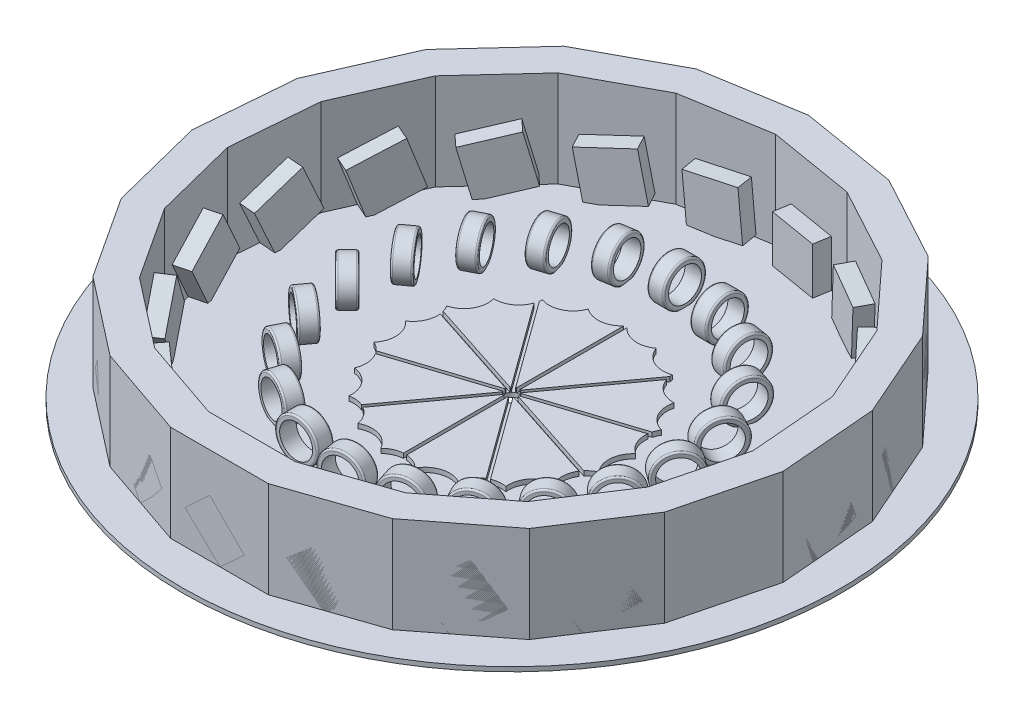
from build123d import *
from build123d.topology import SkipClean

# Parameters (mm, degrees)
SKETCH1_R                 = 100
SKETCH1_R_2               = 2
BASE_PLATTER_DEPTH        = 0.75
INNER_DESIGN_DEPTH        = 2
CUBE_FACE_REFERENCE_DEPTH = 29.8
SKETCH4_W                 = 14.815
SKETCH4_H                 = 14.82
FIRST_CUBE_DEPTH          = 14.82
BOSS_EXTRUDE6_DEPTH       = 14.82
BOSS_EXTRUDE7_DEPTH       = 14.82
BOSS_EXTRUDE9_DEPTH       = 14.82
BOSS_EXTRUDE10_DEPTH      = 14.82
BOSS_EXTRUDE11_DEPTH      = 14.82
BOSS_EXTRUDE12_DEPTH      = 14.82
BOSS_EXTRUDE14_DEPTH      = 14.82
BOSS_EXTRUDE15_DEPTH      = 14.82
BOSS_EXTRUDE16_DEPTH      = 14.82
BOSS_EXTRUDE18_DEPTH      = 14.82
BOSS_EXTRUDE19_DEPTH      = 14.82
BOSS_EXTRUDE20_DEPTH      = 14.82
BOSS_EXTRUDE21_DEPTH      = 14.82
BOSS_EXTRUDE23_DEPTH      = 14.82
BOSS_EXTRUDE24_DEPTH      = 14.82
BOSS_EXTRUDE25_DEPTH      = 14.82
BOSS_EXTRUDE26_DEPTH      = 14.82
BOSS_EXTRUDE27_DEPTH      = 14.82
SKETCH23_W                = 5
SKETCH23_H                = 13
RINGS_DEPTH               = 13
RINGS_2_DEPTH             = 13
RINGS_3_DEPTH             = 13
RINGS_4_DEPTH             = 13
RINGS_5_DEPTH             = 13
RINGS_6_DEPTH             = 13
RINGS_7_DEPTH             = 13
RINGS_8_DEPTH             = 13
RINGS_9_DEPTH             = 13
RINGS_10_DEPTH            = 13
RINGS_11_DEPTH            = 13
SKETCH23_W_2              = 13
SKETCH23_H_2              = 5
RINGS_12_DEPTH            = 13
RINGS_13_DEPTH            = 13
RINGS_14_DEPTH            = 13
RINGS_15_DEPTH            = 13
RINGS_16_DEPTH            = 13
RINGS_17_DEPTH            = 13
RINGS_18_DEPTH            = 13
RINGS_19_DEPTH            = 13
RINGS_20_DEPTH            = 13
SKETCH26_R                = 5
CUT_EXTRUDE2_DEPTH        = 5
SKETCH27_R                = 5
CUT_EXTRUDE3_DEPTH        = 5
SKETCH28_R                = 5
CUT_EXTRUDE4_DEPTH        = 5
SKETCH29_R                = 5
CUT_EXTRUDE5_DEPTH        = 5
SKETCH30_R                = 5
CUT_EXTRUDE6_DEPTH        = 5
SKETCH31_R                = 5
CUT_EXTRUDE7_DEPTH        = 5
SKETCH32_R                = 5
CUT_EXTRUDE8_DEPTH        = 5
SKETCH33_R                = 5
CUT_EXTRUDE9_DEPTH        = 5
SKETCH34_R                = 5
CUT_EXTRUDE10_DEPTH       = 5
SKETCH35_R                = 5
CUT_EXTRUDE11_DEPTH       = 5
SKETCH36_R                = 5
CUT_EXTRUDE12_DEPTH       = 5
SKETCH37_R                = 5
CUT_EXTRUDE13_DEPTH       = 5
SKETCH38_R                = 5
CUT_EXTRUDE14_DEPTH       = 5
SKETCH39_R                = 5
CUT_EXTRUDE15_DEPTH       = 5
SKETCH40_R                = 5
CUT_EXTRUDE16_DEPTH       = 5
SKETCH41_R                = 5
CUT_EXTRUDE17_DEPTH       = 5
SKETCH42_R                = 5
CUT_EXTRUDE18_DEPTH       = 5
SKETCH43_R                = 5
CUT_EXTRUDE19_DEPTH       = 5
SKETCH44_R                = 5
CUT_EXTRUDE20_DEPTH       = 5
SKETCH45_R                = 5
CUT_EXTRUDE21_DEPTH       = 5
SKETCH46_R                = 100
SKETCH46_R_2              = 2
BOSS_EXTRUDE29_DEPTH      = 0.6
FILLET1_R                 = 0.5


with BuildPart() as part:
    # Sketch1 → Base Platter (new body)
    with BuildSketch(Plane(origin=(0, 0, 0), x_dir=(1, 0, 0), z_dir=(0, 1, 0))):
        with Locations(Location((0, 0, 0), (0, 0, 270))):
            Circle(SKETCH1_R)
        with Locations(Location((0, 0, 0), (0, 0, 270))):
            Circle(SKETCH1_R_2, mode=Mode.SUBTRACT)
    extrude(amount=BASE_PLATTER_DEPTH)

    # Sketch2 → Inner Design (add)
    with SkipClean():  # the faces are left unmerged after this step: merging them gives an invalid solid
        with BuildSketch(Plane(origin=(0, 0.75, 0), x_dir=(1, 0, 0), z_dir=(0, 1, 0))):
            with BuildLine():
                Line((1.687204527, 1.073937095), (31.717554771, 10.831389374))
                ThreePointArc((31.717554771, 10.831389374), (32.077866011, 11.840585639), (32.580581203, 12.786935853))
                ThreePointArc((32.580581203, 12.786935853), (28.101088861, 16.224171219), (27.364101886, 21.822143065))
                ThreePointArc((27.364101886, 21.822143065), (22.905478425, 23.11738672), (20.103647043, 26.819645517))
                Line((20.103647043, 26.819645517), (1.542749744, 1.272762047))
                ThreePointArc((1.542749744, 1.272762047), (1.618033989, 1.175570505), (1.687204527, 1.073937095))
            make_face()
            with BuildLine():
                ThreePointArc((34.902132901, 2.615553276), (32.175877146, 5.670588971), (31.498589471, 9.708781011))
                Line((31.498589471, 9.708781011), (1.996221522, 0.122880578))
                ThreePointArc((1.996221522, 0.122880578), (2, 0), (1.996221522, -0.122880578))
                Line((1.996221522, -0.122880578), (31.504359628, -9.710655848))
                ThreePointArc((31.504359628, -9.710655848), (32.706301363, -8.603563459), (34.122476926, -7.788232688))
                ThreePointArc((34.122476926, -7.788232688), (32.357610291, -2.424867667), (34.902132901, 2.615553276))
            make_face()
            with BuildLine():
                ThreePointArc((0.5, 1.936491673), (0.618033989, 1.902113033), (0.733732749, 1.860547299))
                Line((0.733732749, 1.860547299), (19.793527795, 28.094104608))
                ThreePointArc((19.793527795, 28.094104608), (19.74329359, 28.505145312), (19.716202032, 28.918357101))
                ThreePointArc((19.716202032, 28.918357101), (14.078808145, 29.234946351), (10.316431104, 33.445048203))
                ThreePointArc((10.316431104, 33.445048203), (5.226515642, 32.037689702), (0.5, 34.39309779))
                Line((0.5, 34.39309779), (0.5, 1.936491673))
            make_face()
            with BuildLine():
                Line((30.869988169, -10.555998291), (1.687204527, -1.073937095))
                ThreePointArc((1.687204527, -1.073937095), (1.618033989, -1.175570505), (1.542749744, -1.272762047))
                Line((1.542749744, -1.272762047), (19.58219661, -26.101930568))
                ThreePointArc((19.58219661, -26.101930568), (21.661395702, -25.568829433), (23.806045822, -25.656815514))
                ThreePointArc((23.806045822, -25.656815514), (25.369135671, -20.231210597), (30.310889132, -17.5))
                ThreePointArc((30.310889132, -17.5), (29.719147495, -13.957846794), (30.869988169, -10.555998291))
            make_face()
            with BuildLine():
                ThreePointArc((-0.733732749, 1.860547299), (-0.618033989, 1.902113033), (-0.5, 1.936491673))
                Line((-0.5, 1.936491673), (-0.5, 34.39309779))
                ThreePointArc((-0.5, 34.39309779), (-5.226515642, 32.037689702), (-10.316431104, 33.445048203))
                ThreePointArc((-10.316431104, 33.445048203), (-14.078808145, 29.234946351), (-19.716202032, 28.918357101))
                ThreePointArc((-19.716202032, 28.918357101), (-19.74329359, 28.505145312), (-19.793527795, 28.094104608))
                Line((-19.793527795, 28.094104608), (-0.733732749, 1.860547299))
            make_face()
            with BuildLine():
                Line((18.676757461, -26.557002111), (0.733732749, -1.860547299))
                ThreePointArc((0.733732749, -1.860547299), (0.618033989, -1.902113033), (0.5, -1.936491673))
                Line((0.5, -1.936491673), (0.5, -32.465306002))
                ThreePointArc((0.5, -32.465306002), (3.052617651, -33.109544655), (5.216479316, -34.609078918))
                ThreePointArc((5.216479316, -34.609078918), (9.564316834, -31.006753626), (15.185930869, -31.533910377))
                ThreePointArc((15.185930869, -31.533910377), (16.394873379, -28.66917314), (18.676757461, -26.557002111))
            make_face()
            with BuildLine():
                ThreePointArc((-1.687204527, 1.073937095), (-1.618033989, 1.175570505), (-1.542749744, 1.272762047))
                Line((-1.542749744, 1.272762047), (-20.103647043, 26.819645517))
                ThreePointArc((-20.103647043, 26.819645517), (-22.905478425, 23.11738672), (-27.364101886, 21.822143065))
                ThreePointArc((-27.364101886, 21.822143065), (-28.101088861, 16.224171219), (-32.580581203, 12.786935853))
                ThreePointArc((-32.580581203, 12.786935853), (-32.077866011, 11.840585639), (-31.717554771, 10.831389374))
                Line((-31.717554771, 10.831389374), (-1.687204527, 1.073937095))
            make_face()
            with BuildLine():
                Line((-0.5, -32.465306002), (-0.5, -1.936491673))
                ThreePointArc((-0.5, -1.936491673), (-0.618033989, -1.902113033), (-0.733732749, -1.860547299))
                Line((-0.733732749, -1.860547299), (-18.676757461, -26.557002111))
                ThreePointArc((-18.676757461, -26.557002111), (-16.394873379, -28.66917314), (-15.185930869, -31.533910377))
                ThreePointArc((-15.185930869, -31.533910377), (-9.564316834, -31.006753626), (-5.216479316, -34.609078918))
                ThreePointArc((-5.216479316, -34.609078918), (-3.052617651, -33.109544655), (-0.5, -32.465306002))
            make_face()
            with BuildLine():
                ThreePointArc((-1.996221522, -0.122880578), (-2, 0), (-1.996221522, 0.122880578))
                Line((-1.996221522, 0.122880578), (-31.498589471, 9.708781011))
                ThreePointArc((-31.498589471, 9.708781011), (-32.175877146, 5.670588971), (-34.902132901, 2.615553276))
                ThreePointArc((-34.902132901, 2.615553276), (-32.357610291, -2.424867667), (-34.122476926, -7.788232688))
                ThreePointArc((-34.122476926, -7.788232688), (-32.706301363, -8.603563459), (-31.504359628, -9.710655848))
                Line((-31.504359628, -9.710655848), (-1.996221522, -0.122880578))
            make_face()
            with BuildLine():
                ThreePointArc((-1.542749744, -1.272762047), (-1.618033989, -1.175570505), (-1.687204527, -1.073937095))
                Line((-1.687204527, -1.073937095), (-30.869988169, -10.555998291))
                ThreePointArc((-30.869988169, -10.555998291), (-29.719147495, -13.957846794), (-30.310889132, -17.5))
                ThreePointArc((-30.310889132, -17.5), (-25.369135671, -20.231210597), (-23.806045822, -25.656815514))
                ThreePointArc((-23.806045822, -25.656815514), (-21.661395702, -25.568829433), (-19.58219661, -26.101930568))
                Line((-19.58219661, -26.101930568), (-1.542749744, -1.272762047))
            make_face()
        extrude(amount=INNER_DESIGN_DEPTH)



with BuildPart() as body_2:
    # Sketch3 → Cube Face Reference (new body)
    with BuildSketch(Plane(origin=(0, 0.75, 0), x_dir=(1, 0, 0), z_dir=(0, 1, 0))):
        Polygon((0, 90), (-29.222952228, 85.123551753), (-55.279144142, 71.022645846), (-75.344983044, 49.225334231), (-87.246023935, 22.093693843), (-89.692604371, -7.432141093), (-82.419599399, -36.152588219), (-66.215151961, -60.955341446), (-42.835265373, -79.152637609), (-14.813513125, -88.772517306), (14.813513125, -88.772517306), (42.835265373, -79.152637609), (66.215151961, -60.955341446), (82.419599399, -36.152588219), (89.692604371, -7.432141093), (87.246023935, 22.093693843), (75.344983044, 49.225334231), (55.279144142, 71.022645846), (29.222952228, 85.123551753), align=None)
        Polygon((0, 80), (-25.975957536, 75.665379336), (-49.137017015, 63.131240752), (-66.973318261, 43.75585265), (-77.552021275, 19.638838971), (-79.726759441, -6.606347638), (-73.261866132, -32.135633972), (-58.857912854, -54.18252573), (-38.075791443, -70.357900097), (-13.167567222, -78.908904272), (13.167567222, -78.908904272), (38.075791443, -70.357900097), (58.857912854, -54.18252573), (73.261866132, -32.135633972), (79.726759441, -6.606347638), (77.552021275, 19.638838971), (66.973318261, 43.75585265), (49.137017015, 63.131240752), (25.975957536, 75.665379336), align=None, mode=Mode.SUBTRACT)
    extrude(amount=CUBE_FACE_REFERENCE_DEPTH)


with BuildPart() as body_3:
    # Sketch4 → First Cube (new body)
    with BuildSketch(Plane(origin=(14.611476114, 0, -87.561775877), x_dir=(-0.9863613034027224, 0, -0.1645945902807338), z_dir=(0.1645945902807338, 0, -0.9863613034027224))):
        with Locations((0, 8.16)):
            Rectangle(SKETCH4_W, SKETCH4_H)
    extrude(amount=-FIRST_CUBE_DEPTH)


with BuildPart() as body_4:
    # Sketch5 → Boss-Extrude6 (new body)
    with BuildSketch(Plane(origin=(42.251048185, 0, -78.073098799), x_dir=(-0.879473751206489, 0, -0.4759473930370738), z_dir=(0.4759473930370738, 0, -0.879473751206489))):
        Polygon((-6.772778143, 0.75), (7.996604043, 1.9738259), (6.772778143, 16.743208086), (-7.996604043, 15.519382186), align=None)
    extrude(amount=-BOSS_EXTRUDE6_DEPTH)


with BuildPart() as body_5:
    # Sketch6 → Boss-Extrude7 (new body)
    with BuildSketch(Plane(origin=(65.312063593, 0, -60.123990038), x_dir=(-0.6772815716257411, 0, -0.7357239106731317), z_dir=(0.7357239106731317, 0, -0.6772815716257411))):
        Polygon((-6.089291344, 0.75), (-8.528583172, 15.367874516), (6.089291344, 17.807166344), (8.528583172, 3.189291828), align=None)
    extrude(amount=-BOSS_EXTRUDE7_DEPTH)


with BuildPart() as body_6:
    # Sketch7 → Boss-Extrude9 (new body)
    with BuildSketch(Plane(origin=(81.295503489, 0, -35.659514037), x_dir=(-0.4016954246529692, 0, -0.9157733266550576), z_dir=(0.9157733266550576, 0, -0.4016954246529692))):
        Polygon((-5.364208511, 0.75), (-9.00230343, 15.116511941), (5.364208511, 18.754606861), (9.00230343, 4.388094919), align=None)
    extrude(amount=-BOSS_EXTRUDE9_DEPTH)


with BuildPart() as body_7:
    # Sketch8 → Boss-Extrude10 (new body)
    with BuildSketch(Plane(origin=(88.469314153, 0, -7.330776375), x_dir=(-0.08257934547233238, 0, -0.9965844930066698), z_dir=(0.99658449300667, 0, -0.0825793454723324))):
        Polygon((-4.602482694, 0.75), (-9.414528828, 14.767011522), (4.602482694, 19.579057656), (9.414528828, 5.562046134), align=None)
    extrude(amount=-BOSS_EXTRUDE10_DEPTH)


with BuildPart() as body_8:
    # Sketch9 → Boss-Extrude11 (new body)
    with BuildSketch(Plane(origin=(86.056101885, 0, 21.792364656), x_dir=(0.24548548714079937, 0, -0.9694002659393304), z_dir=(0.9694002659393305, 0, 0.2454854871407994))):
        Polygon((3.809317254, 20.274886894), (-9.762443447, 14.321760701), (0, 10.512443447), align=None)
        Polygon((0, 10.512443447), (9.762443447, 6.703126193), (3.809317254, 20.274886894), align=None)
        Polygon((0, 10.512443447), (-3.809317254, 0.75), (9.762443447, 6.703126193), align=None)
        Polygon((-9.762443447, 14.321760701), (-3.809317254, 0.75), (0, 10.512443447), align=None)
    extrude(amount=-BOSS_EXTRUDE11_DEPTH)


with BuildPart() as body_9:
    # Sketch10 → Boss-Extrude12 (new body)
    with BuildSketch(Plane(origin=(74.31737568, 0, 48.553964833), x_dir=(0.5469481581224269, 0, -0.8371664782625287), z_dir=(0.8371664782625287, 0, 0.5469481581224269))):
        Polygon((-2.990130314, 0.75), (-10.043670679, 13.783800993), (2.990130314, 20.837341358), (10.043670679, 7.803540365), align=None)
    extrude(amount=-BOSS_EXTRUDE12_DEPTH)


with BuildPart() as body_10:
    # Sketch11 → Boss-Extrude14 (new body)
    with BuildSketch(Plane(origin=(54.525208667, 0, 70.053989527), x_dir=(0.7891405093963932, 0, -0.6142127126896683), z_dir=(0.6142127126896683, 0, 0.7891405093963932))):
        Polygon((-2.150517752, 0.75), (-10.256289456, 13.156807208), (2.150517752, 21.262578911), (10.256289456, 8.855771703), align=None)
    extrude(amount=-BOSS_EXTRUDE14_DEPTH)


with BuildPart() as body_11:
    # Sketch12 → Boss-Extrude15 (new body)
    with BuildSketch(Plane(origin=(28.824389249, 0, 83.962577457), x_dir=(0.9458172417006347, 0, -0.3246994692046836), z_dir=(0.3246994692046836, 0, 0.9458172417006347))):
        Polygon((-1.296214974, 0.75), (-10.398847376, 12.445062349), (1.296214974, 21.547694751), (10.398847376, 9.852632402), align=None)
    extrude(amount=-BOSS_EXTRUDE15_DEPTH)


with BuildPart() as body_12:
    # Sketch13 → Boss-Extrude16 (new body)
    with BuildSketch(Plane.XY.offset(88.772517306)):
        Polygon((-0.433057732, 0.75), (-10.470370624, 11.653428356), (0.433057732, 21.690741248), (10.470370624, 10.787312891), align=None)
    extrude(amount=-BOSS_EXTRUDE16_DEPTH)


with BuildPart() as body_13:
    # Sketch14 → Boss-Extrude18 (new body)
    with BuildSketch(Plane(origin=(-28.824389249, 0, 83.962577457), x_dir=(0.9458172417006347, 0, 0.3246994692046836), z_dir=(-0.3246994692046836, 0, 0.9458172417006347))):
        Polygon((0.433057732, 0.75), (-10.470370624, 10.787312891), (-0.433057732, 21.690741248), (10.470370624, 11.653428356), align=None)
    extrude(amount=-BOSS_EXTRUDE18_DEPTH)


with BuildPart() as body_14:
    # Sketch15 → Boss-Extrude19 (new body)
    with BuildSketch(Plane(origin=(-54.525208667, 0, 70.053989527), x_dir=(0.7891405093963937, 0, 0.6142127126896679), z_dir=(-0.6142127126896679, 0, 0.7891405093963937))):
        Polygon((1.296214974, 0.75), (-10.398847376, 9.852632402), (-1.296214974, 21.547694751), (10.398847376, 12.445062349), align=None)
    extrude(amount=-BOSS_EXTRUDE19_DEPTH)


with BuildPart() as body_15:
    # Sketch16 → Boss-Extrude20 (new body)
    with BuildSketch(Plane(origin=(-74.31737568, 0, 48.553964833), x_dir=(0.5469481581224271, 0, 0.8371664782625285), z_dir=(-0.8371664782625284, 0, 0.546948158122427))):
        Polygon((2.150517752, 0.75), (-10.256289456, 8.855771703), (-2.150517752, 21.262578911), (10.256289456, 13.156807208), align=None)
    extrude(amount=-BOSS_EXTRUDE20_DEPTH)


with BuildPart() as body_16:
    # Sketch17 → Boss-Extrude21 (new body)
    with BuildSketch(Plane(origin=(-86.056101885, 0, 21.792364656), x_dir=(0.24548548714079926, 0, 0.9694002659393304), z_dir=(-0.9694002659393305, 0, 0.2454854871407993))):
        Polygon((2.990130314, 0.75), (-10.043670679, 7.803540365), (-2.990130314, 20.837341358), (10.043670679, 13.783800993), align=None)
    extrude(amount=-BOSS_EXTRUDE21_DEPTH)


with BuildPart() as body_17:
    # Sketch18 → Boss-Extrude23 (new body)
    with BuildSketch(Plane(origin=(-88.469314153, 0, -7.330776375), x_dir=(-0.08257934547233221, 0, 0.9965844930066698), z_dir=(-0.99658449300667, 0, -0.08257934547233223))):
        Polygon((3.809317254, 0.75), (-9.762443447, 6.703126193), (-3.809317254, 20.274886894), (9.762443447, 14.321760701), align=None)
    extrude(amount=-BOSS_EXTRUDE23_DEPTH)


with BuildPart() as body_18:
    # Sketch19 → Boss-Extrude24 (new body)
    with BuildSketch(Plane(origin=(-81.295503489, 0, -35.659514037), x_dir=(-0.40169542465296904, 0, 0.9157733266550577), z_dir=(-0.9157733266550576, 0, -0.401695424652969))):
        Polygon((4.602482694, 0.75), (-9.414528828, 5.562046134), (-4.602482694, 19.579057656), (9.414528828, 14.767011522), align=None)
    extrude(amount=-BOSS_EXTRUDE24_DEPTH)


with BuildPart() as body_19:
    # Sketch20 → Boss-Extrude25 (new body)
    with BuildSketch(Plane(origin=(-65.312063593, 0, -60.123990038), x_dir=(-0.6772815716257413, 0, 0.7357239106731314), z_dir=(-0.7357239106731314, 0, -0.6772815716257413))):
        Polygon((5.364208511, 0.75), (-9.00230343, 4.388094919), (-5.364208511, 18.754606861), (9.00230343, 15.116511941), align=None)
    extrude(amount=-BOSS_EXTRUDE25_DEPTH)


with BuildPart() as body_20:
    # Sketch21 → Boss-Extrude26 (new body)
    with BuildSketch(Plane(origin=(-42.251048185, 0, -78.073098799), x_dir=(-0.8794737512064889, 0, 0.47594739303707395), z_dir=(-0.47594739303707395, 0, -0.8794737512064889))):
        Polygon((6.089291344, 0.75), (-8.528583172, 3.189291828), (-6.089291344, 17.807166344), (8.528583172, 15.367874516), align=None)
    extrude(amount=-BOSS_EXTRUDE26_DEPTH)


with BuildPart() as body_21:
    # Sketch22 → Boss-Extrude27 (new body)
    with BuildSketch(Plane(origin=(-14.611476114, 0, -87.561775877), x_dir=(-0.9863613034027224, 0, 0.16459459028073373), z_dir=(-0.16459459028073373, 0, -0.9863613034027224))):
        Polygon((6.772778143, 0.75), (-7.996604043, 1.9738259), (-6.772778143, 16.743208086), (7.996604043, 15.519382186), align=None)
    extrude(amount=-BOSS_EXTRUDE27_DEPTH)


with BuildPart() as body_22:
    # Sketch23 → Rings (new body)
    with BuildSketch(Plane(origin=(0, 0.75, 0), x_dir=(1, 0, 0), z_dir=(0, 1, 0))):
        with Locations((15.450849719, 47.552825815)):
            Rectangle(SKETCH23_W, SKETCH23_H)
    extrude(amount=RINGS_DEPTH)

    # Sketch28 → Cut-Extrude4 (cut)
    with BuildSketch(Plane(origin=(17.950849719, 0, 0), x_dir=(0, 0, -1), z_dir=(1, 0, 0))):
        with BuildLine():
            Line((47.552825815, 13.75), (41.052825815, 13.75))
            Line((41.052825815, 13.75), (41.052825815, 7.25))
            ThreePointArc((41.052825815, 7.25), (42.956631737, 11.846194078), (47.552825815, 13.75))
        make_face()
        with BuildLine():
            ThreePointArc((47.552825815, 0.75), (42.956631737, 2.653805922), (41.052825815, 7.25))
            Line((41.052825815, 7.25), (41.052825815, 0.75))
            Line((41.052825815, 0.75), (47.552825815, 0.75))
        make_face()
        with Locations((47.552825815, 7.25)):
            Circle(SKETCH28_R)
        with BuildLine():
            Line((54.052825815, 13.75), (47.552825815, 13.75))
            ThreePointArc((47.552825815, 13.75), (52.149019892, 11.846194078), (54.052825815, 7.25))
            Line((54.052825815, 7.25), (54.052825815, 13.75))
        make_face()
        with BuildLine():
            Line((54.052825815, 0.75), (54.052825815, 7.25))
            ThreePointArc((54.052825815, 7.25), (52.149019892, 2.653805922), (47.552825815, 0.75))
            Line((47.552825815, 0.75), (54.052825815, 0.75))
        make_face()
    extrude(amount=-CUT_EXTRUDE4_DEPTH, mode=Mode.SUBTRACT)


with BuildPart() as body_23:
    # Sketch23 → Rings 2 (new body)
    with BuildSketch(Plane(origin=(0, 0.75, 0), x_dir=(1, 0, 0), z_dir=(0, 1, 0))):
        with Locations((0, 50)):
            Rectangle(SKETCH23_W, SKETCH23_H)
    extrude(amount=RINGS_2_DEPTH)

    # Sketch27 → Cut-Extrude3 (cut)
    with BuildSketch(Plane(origin=(2.5, 0, 0), x_dir=(0, 0, -1), z_dir=(1, 0, 0))):
        with Locations((50, 7.25)):
            Circle(SKETCH27_R)
        with BuildLine():
            Line((50, 13.75), (43.5, 13.75))
            Line((43.5, 13.75), (43.5, 7.25))
            ThreePointArc((43.5, 7.25), (45.403805922, 11.846194078), (50, 13.75))
        make_face()
        with BuildLine():
            ThreePointArc((50, 0.75), (45.403805922, 2.653805922), (43.5, 7.25))
            Line((43.5, 7.25), (43.5, 0.75))
            Line((43.5, 0.75), (50, 0.75))
        make_face()
        with BuildLine():
            Line((56.5, 13.75), (50, 13.75))
            ThreePointArc((50, 13.75), (54.596194078, 11.846194078), (56.5, 7.25))
            Line((56.5, 7.25), (56.5, 13.75))
        make_face()
        with BuildLine():
            Line((56.5, 0.75), (56.5, 7.25))
            ThreePointArc((56.5, 7.25), (54.596194078, 2.653805922), (50, 0.75))
            Line((50, 0.75), (56.5, 0.75))
        make_face()
    extrude(amount=-CUT_EXTRUDE3_DEPTH, mode=Mode.SUBTRACT)


with BuildPart() as body_24:
    # Sketch23 → Rings 3 (new body)
    with BuildSketch(Plane(origin=(0, 0.75, 0), x_dir=(1, 0, 0), z_dir=(0, 1, 0))):
        Polygon((27.936865786, 47.261910095), (32.875307489, 46.47973777), (30.841659443, 33.639789342), (25.90321774, 34.421961667), align=None)
    extrude(amount=RINGS_3_DEPTH)

    # Sketch29 → Cut-Extrude5 (cut)
    with BuildSketch(Plane(origin=(24.889277018, 0, 3.942074211), x_dir=(0.15643446504023656, 0, -0.9876883405951369), z_dir=(0.9876883405951368, 0, 0.15643446504023653))):
        with Locations((44.550326209, 7.25)):
            Circle(SKETCH29_R)
        with BuildLine():
            Line((44.550326209, 13.75), (38.050326209, 13.75))
            Line((38.050326209, 13.75), (38.050326209, 7.25))
            ThreePointArc((38.050326209, 7.25), (39.954132132, 11.846194078), (44.550326209, 13.75))
        make_face()
        with BuildLine():
            ThreePointArc((44.550326209, 0.75), (39.954132132, 2.653805922), (38.050326209, 7.25))
            Line((38.050326209, 7.25), (38.050326209, 0.75))
            Line((38.050326209, 0.75), (44.550326209, 0.75))
        make_face()
        with BuildLine():
            Line((51.050326209, 0.75), (51.050326209, 7.25))
            ThreePointArc((51.050326209, 7.25), (49.146520287, 2.653805922), (44.550326209, 0.75))
            Line((44.550326209, 0.75), (51.050326209, 0.75))
        make_face()
        with BuildLine():
            Line((51.050326209, 13.75), (44.550326209, 13.75))
            ThreePointArc((44.550326209, 13.75), (49.146520287, 11.846194078), (51.050326209, 7.25))
            Line((51.050326209, 7.25), (51.050326209, 13.75))
        make_face()
    extrude(amount=-CUT_EXTRUDE5_DEPTH, mode=Mode.SUBTRACT)


with BuildPart() as body_25:
    # Sketch23 → Rings 4 (new body)
    with BuildSketch(Plane(origin=(0, 0.75, 0), x_dir=(1, 0, 0), z_dir=(0, 1, 0))):
        Polygon((40.081818891, 36.343672456), (36.064597965, 23.979937745), (40.819880546, 22.434852773), (44.837101473, 34.798587485), align=None)
    extrude(amount=RINGS_4_DEPTH)

    # Sketch30 → Cut-Extrude6 (cut)
    with BuildSketch(Plane(origin=(30.328491009, 0, 9.854324086), x_dir=(0.3090169943749453, 0, -0.9510565162951543), z_dir=(0.9510565162951544, 0, 0.3090169943749453))):
        with BuildLine():
            Line((40.450849719, 13.75), (33.950849719, 13.75))
            Line((33.950849719, 13.75), (33.950849719, 7.25))
            ThreePointArc((33.950849719, 7.25), (35.854655641, 11.846194078), (40.450849719, 13.75))
        make_face()
        with BuildLine():
            ThreePointArc((40.450849719, 0.75), (35.854655641, 2.653805922), (33.950849719, 7.25))
            Line((33.950849719, 7.25), (33.950849719, 0.75))
            Line((33.950849719, 0.75), (40.450849719, 0.75))
        make_face()
        with Locations((40.450849719, 7.25)):
            Circle(SKETCH30_R)
        with BuildLine():
            Line((46.950849719, 13.75), (40.450849719, 13.75))
            ThreePointArc((40.450849719, 13.75), (45.047043796, 11.846194078), (46.950849719, 7.25))
            Line((46.950849719, 7.25), (46.950849719, 13.75))
        make_face()
        with BuildLine():
            Line((46.950849719, 0.75), (46.950849719, 7.25))
            ThreePointArc((46.950849719, 7.25), (45.047043796, 2.653805922), (40.450849719, 0.75))
            Line((40.450849719, 0.75), (46.950849719, 0.75))
        make_face()
    extrude(amount=-CUT_EXTRUDE6_DEPTH, mode=Mode.SUBTRACT)


with BuildPart() as body_26:
    # Sketch23 → Rings 5 (new body)
    with BuildSketch(Plane(origin=(0, 0.75, 0), x_dir=(1, 0, 0), z_dir=(0, 1, 0))):
        Polygon((48.276247753, 22.377368375), (42.374371256, 10.794283561), (46.829403877, 8.524331062), (52.731280374, 20.107415877), align=None)
    extrude(amount=RINGS_5_DEPTH)

    # Sketch31 → Cut-Extrude7 (cut)
    with BuildSketch(Plane(origin=(33.729354077, 0, 17.185964297), x_dir=(0.4539904997395454, 0, -0.8910065241883687), z_dir=(0.8910065241883686, 0, 0.45399049973954536))):
        with BuildLine():
            Line((35.355339059, 13.75), (28.855339059, 13.75))
            Line((28.855339059, 13.75), (28.855339059, 7.25))
            ThreePointArc((28.855339059, 7.25), (30.759144982, 11.846194078), (35.355339059, 13.75))
        make_face()
        with BuildLine():
            ThreePointArc((35.355339059, 0.75), (30.759144982, 2.653805922), (28.855339059, 7.25))
            Line((28.855339059, 7.25), (28.855339059, 0.75))
            Line((28.855339059, 0.75), (35.355339059, 0.75))
        make_face()
        with Locations((35.355339059, 7.25)):
            Circle(SKETCH31_R)
        with BuildLine():
            Line((41.855339059, 13.75), (35.355339059, 13.75))
            ThreePointArc((35.355339059, 13.75), (39.951533137, 11.846194078), (41.855339059, 7.25))
            Line((41.855339059, 7.25), (41.855339059, 13.75))
        make_face()
        with BuildLine():
            Line((41.855339059, 0.75), (41.855339059, 7.25))
            ThreePointArc((41.855339059, 7.25), (39.951533137, 2.653805922), (35.355339059, 0.75))
            Line((35.355339059, 0.75), (41.855339059, 0.75))
        make_face()
    extrude(amount=-CUT_EXTRUDE7_DEPTH, mode=Mode.SUBTRACT)


with BuildPart() as body_27:
    # Sketch23 → Rings 6 (new body)
    with BuildSketch(Plane(origin=(0, 0.75, 0), x_dir=(1, 0, 0), z_dir=(0, 1, 0))):
        Polygon((51.798061654, 6.728073594), (44.156853374, -3.789147333), (48.201938346, -6.728073594), (55.843146626, 3.789147333), align=None)
    extrude(amount=RINGS_6_DEPTH)

    # Sketch32 → Cut-Extrude8 (cut)
    with BuildSketch(Plane(origin=(34.747967345, 0, 25.245876038), x_dir=(0.5877852522924715, 0, -0.8090169943749487), z_dir=(0.8090169943749487, 0, 0.5877852522924715))):
        with BuildLine():
            Line((29.389262615, 13.75), (22.889262615, 13.75))
            Line((22.889262615, 13.75), (22.889262615, 7.25))
            ThreePointArc((22.889262615, 7.25), (24.793068537, 11.846194078), (29.389262615, 13.75))
        make_face()
        with BuildLine():
            ThreePointArc((29.389262615, 0.75), (24.793068537, 2.653805922), (22.889262615, 7.25))
            Line((22.889262615, 7.25), (22.889262615, 0.75))
            Line((22.889262615, 0.75), (29.389262615, 0.75))
        make_face()
        with Locations((29.389262615, 7.25)):
            Circle(SKETCH32_R)
        with BuildLine():
            Line((35.889262615, 13.75), (29.389262615, 13.75))
            ThreePointArc((29.389262615, 13.75), (33.985456692, 11.846194078), (35.889262615, 7.25))
            Line((35.889262615, 7.25), (35.889262615, 13.75))
        make_face()
        with BuildLine():
            Line((35.889262615, 0.75), (35.889262615, 7.25))
            ThreePointArc((35.889262615, 7.25), (33.985456692, 2.653805922), (29.389262615, 0.75))
            Line((29.389262615, 0.75), (35.889262615, 0.75))
        make_face()
    extrude(amount=-CUT_EXTRUDE8_DEPTH, mode=Mode.SUBTRACT)


with BuildPart() as body_28:
    # Sketch23 → Rings 7 (new body)
    with BuildSketch(Plane(origin=(0, 0.75, 0), x_dir=(1, 0, 0), z_dir=(0, 1, 0))):
        Polygon((50.38125294, -9.086888688), (41.188864784, -18.279276843), (44.72439869, -21.814810749), (53.916786845, -12.622422594), align=None)
    extrude(amount=RINGS_7_DEPTH)

    # Sketch33 → Cut-Extrude9 (cut)
    with BuildSketch(Plane(origin=(33.26960472, 0, 33.26960472), x_dir=(0.7071067811865459, 0, -0.7071067811865492), z_dir=(0.7071067811865492, 0, 0.7071067811865459))):
        with BuildLine():
            Line((22.699524987, 13.75), (16.199524987, 13.75))
            Line((16.199524987, 13.75), (16.199524987, 7.249999993))
            ThreePointArc((16.199524987, 7.249999993), (18.103330907, 11.846194075), (22.699524987, 13.75))
        make_face()
        with BuildLine():
            ThreePointArc((22.699524987, 0.75), (18.103330912, 2.65380592), (16.199524987, 7.249999993))
            Line((16.199524987, 7.249999993), (16.199524987, 0.75))
            Line((16.199524987, 0.75), (22.699524987, 0.75))
        make_face()
        with Locations((22.699524987, 7.25)):
            Circle(SKETCH33_R)
        with BuildLine():
            Line((29.199524987, 13.75), (22.699524987, 13.75))
            ThreePointArc((22.699524987, 13.75), (27.295719065, 11.846194078), (29.199524987, 7.25))
            Line((29.199524987, 7.25), (29.199524987, 13.75))
        make_face()
        with BuildLine():
            Line((29.199524987, 0.75), (29.199524987, 7.25))
            ThreePointArc((29.199524987, 7.25), (27.295719065, 2.653805922), (22.699524987, 0.75))
            Line((22.699524987, 0.75), (29.199524987, 0.75))
        make_face()
    extrude(amount=-CUT_EXTRUDE9_DEPTH, mode=Mode.SUBTRACT)


with BuildPart() as body_29:
    # Sketch23 → Rings 8 (new body)
    with BuildSketch(Plane(origin=(0, 0.75, 0), x_dir=(1, 0, 0), z_dir=(0, 1, 0))):
        Polygon((44.239997051, -23.546115989), (33.722776125, -31.187324269), (36.661702386, -35.23240924), (47.178923313, -27.591200961), align=None)
    extrude(amount=RINGS_8_DEPTH)

    # Sketch34 → Cut-Extrude10 (cut)
    with BuildSketch(Plane(origin=(29.420312849, 0, 40.493586701), x_dir=(0.8090169943749453, 0, -0.587785252292476), z_dir=(0.587785252292476, 0, 0.8090169943749453))):
        with BuildLine():
            ThreePointArc((15.450849719, 0.75), (10.854655641, 2.653805922), (8.950849719, 7.25))
            Line((8.950849719, 7.25), (8.950849719, 0.75))
            Line((8.950849719, 0.75), (15.450849719, 0.75))
        make_face()
        with BuildLine():
            Line((15.450849719, 13.75), (8.950849719, 13.75))
            Line((8.950849719, 13.75), (8.950849719, 7.25))
            ThreePointArc((8.950849719, 7.25), (10.854655641, 11.846194078), (15.450849719, 13.75))
        make_face()
        with Locations((15.450849719, 7.25)):
            Circle(SKETCH34_R)
        with BuildLine():
            Line((21.950849719, 13.75), (15.450849719, 13.75))
            ThreePointArc((15.450849719, 13.75), (20.047043796, 11.846194078), (21.950849719, 7.25))
            Line((21.950849719, 7.25), (21.950849719, 13.75))
        make_face()
        with BuildLine():
            Line((21.950849719, 0.75), (21.950849719, 7.25))
            ThreePointArc((21.950849719, 7.25), (20.047043796, 2.653805922), (15.450849719, 0.75))
            Line((15.450849719, 0.75), (21.950849719, 0.75))
        make_face()
    extrude(amount=-CUT_EXTRUDE10_DEPTH, mode=Mode.SUBTRACT)


with BuildPart() as body_30:
    # Sketch23 → Rings 9 (new body)
    with BuildSketch(Plane(origin=(0, 0.75, 0), x_dir=(1, 0, 0), z_dir=(0, 1, 0))):
        Polygon((24.732696457, -45.629304278), (36.315781271, -39.727427781), (34.045828772, -35.27239516), (22.462743958, -41.174271657), align=None)
    extrude(amount=RINGS_9_DEPTH)

    # Sketch35 → Cut-Extrude11 (cut)
    with BuildSketch(Plane(origin=(23.555032416, 0, 46.229354077), x_dir=(0.8910065241883667, 0, -0.4539904997395491), z_dir=(0.4539904997395491, 0, 0.8910065241883667))):
        with BuildLine():
            ThreePointArc((7.821723265, 0.75), (3.225529181, 2.653805915), (1.321723252, 7.249999993))
            Line((1.321723252, 7.249999993), (1.321723252, 0.75))
            Line((1.321723252, 0.75), (7.821723265, 0.75))
        make_face()
        with BuildLine():
            Line((7.821723252, 13.75), (1.321723252, 13.75))
            Line((1.321723252, 13.75), (1.321723252, 7.249999993))
            ThreePointArc((1.321723252, 7.249999993), (3.225529172, 11.846194075), (7.821723252, 13.75))
        make_face()
        with Locations((7.821723252, 7.25)):
            Circle(SKETCH35_R)
        with BuildLine():
            Line((14.321723252, 13.75), (7.821723252, 13.75))
            ThreePointArc((7.821723252, 13.75), (12.41791733, 11.846194078), (14.321723252, 7.25))
            Line((14.321723252, 7.25), (14.321723252, 13.75))
        make_face()
        with BuildLine():
            Line((14.321723252, 0.75), (14.321723252, 7.25))
            ThreePointArc((14.321723252, 7.25), (12.417917334, 2.653805927), (7.821723265, 0.75))
            Line((7.821723265, 0.75), (14.321723252, 0.75))
        make_face()
    extrude(amount=-CUT_EXTRUDE11_DEPTH, mode=Mode.SUBTRACT)


with BuildPart() as body_31:
    # Sketch23 → Rings 10 (new body)
    with BuildSketch(Plane(origin=(0, 0.75, 0), x_dir=(1, 0, 0), z_dir=(0, 1, 0))):
        Polygon((10.041524849, -51.939077569), (22.405259561, -47.921856642), (20.860174589, -43.166574061), (8.496439877, -47.183794987), align=None)
    extrude(amount=RINGS_10_DEPTH)

    # Sketch36 → Cut-Extrude12 (cut)
    with BuildSketch(Plane(origin=(16.223392205, 0, 49.930467105), x_dir=(0.9510565162951524, 0, -0.30901699437495117), z_dir=(0.3090169943749511, 0, 0.9510565162951523))):
        with BuildLine():
            Line((0, 13.75), (-6.5, 13.75))
            Line((-6.5, 13.75), (-6.5, 7.25))
            ThreePointArc((-6.5, 7.25), (-4.596194078, 11.846194078), (0, 13.75))
        make_face()
        with BuildLine():
            ThreePointArc((-4.3e-08, 0.75), (-4.596194093, 2.653805937), (-6.5, 7.25))
            Line((-6.5, 7.25), (-6.5, 0.75))
            Line((-6.5, 0.75), (-4.3e-08, 0.75))
        make_face()
        with Locations((0, 7.25)):
            Circle(SKETCH36_R)
        with BuildLine():
            Line((6.5, 0.75), (6.5, 7.25))
            ThreePointArc((6.5, 7.25), (4.596194063, 2.653805907), (-4.3e-08, 0.75))
            Line((-4.3e-08, 0.75), (6.5, 0.75))
        make_face()
        with BuildLine():
            Line((6.5, 13.75), (0, 13.75))
            ThreePointArc((0, 13.75), (4.596194078, 11.846194078), (6.5, 7.25))
            Line((6.5, 7.25), (6.5, 13.75))
        make_face()
    extrude(amount=-CUT_EXTRUDE12_DEPTH, mode=Mode.SUBTRACT)


with BuildPart() as body_32:
    # Sketch23 → Rings 11 (new body)
    with BuildSketch(Plane(origin=(0, 0.75, 0), x_dir=(1, 0, 0), z_dir=(0, 1, 0))):
        Polygon((-6.028888051, -53.486044874), (6.811060376, -51.452396829), (6.028888051, -46.513955126), (-6.811060376, -48.547603171), align=None)
    extrude(amount=RINGS_11_DEPTH)

    # Sketch37 → Cut-Extrude13 (cut)
    with BuildSketch(Plane(origin=(8.116511022, 0, 51.245633759), x_dir=(0.9876883405951373, 0, -0.156434465040234), z_dir=(0.156434465040234, 0, 0.9876883405951373))):
        with BuildLine():
            Line((-14.321723252, 13.75), (-14.321723252, 7.25))
            ThreePointArc((-14.321723252, 7.25), (-12.41791733, 11.846194078), (-7.821723252, 13.75))
            Line((-7.821723252, 13.75), (-14.321723252, 13.75))
        make_face()
        with BuildLine():
            Line((-14.321723252, 0.75), (-7.821723245, 0.75))
            ThreePointArc((-7.821723245, 0.75), (-12.417917327, 2.65380592), (-14.321723252, 7.25))
            Line((-14.321723252, 7.25), (-14.321723252, 0.75))
        make_face()
        with Locations((-7.821723252, 7.25)):
            Circle(SKETCH37_R)
        with BuildLine():
            ThreePointArc((-7.821723252, 13.75), (-3.225529174, 11.846194078), (-1.321723252, 7.25))
            Line((-1.321723252, 7.25), (-1.321723252, 13.75))
            Line((-1.321723252, 13.75), (-7.821723252, 13.75))
        make_face()
        with BuildLine():
            Line((-7.821723245, 0.75), (-1.321723252, 0.75))
            Line((-1.321723252, 0.75), (-1.321723252, 7.25))
            ThreePointArc((-1.321723252, 7.25), (-3.225529172, 2.653805925), (-7.821723245, 0.75))
        make_face()
    extrude(amount=-CUT_EXTRUDE13_DEPTH, mode=Mode.SUBTRACT)


with BuildPart() as body_33:
    # Sketch23 → Rings 12 (new body)
    with BuildSketch(Plane(origin=(0, 0.75, 0), x_dir=(1, 0, 0), z_dir=(0, 1, 0))):
        with Locations((-15.450849719, -47.552825815)):
            Rectangle(SKETCH23_W_2, SKETCH23_H_2)
    extrude(amount=RINGS_12_DEPTH)

    # Sketch38 → Cut-Extrude14 (cut)
    with BuildSketch(Plane.XY.offset(50.052825815)):
        with BuildLine():
            Line((-15.450849719, 13.75), (-21.950849719, 13.75))
            Line((-21.950849719, 13.75), (-21.950849719, 7.25))
            ThreePointArc((-21.950849719, 7.25), (-20.047043796, 11.846194078), (-15.450849719, 13.75))
        make_face()
        with BuildLine():
            ThreePointArc((-15.450849719, 0.75), (-20.047043796, 2.653805922), (-21.950849719, 7.25))
            Line((-21.950849719, 7.25), (-21.950849719, 0.75))
            Line((-21.950849719, 0.75), (-15.450849719, 0.75))
        make_face()
        with Locations((-15.450849719, 7.25)):
            Circle(SKETCH38_R)
        with BuildLine():
            Line((-8.950849719, 13.75), (-15.450849719, 13.75))
            ThreePointArc((-15.450849719, 13.75), (-10.854655641, 11.846194078), (-8.950849719, 7.25))
            Line((-8.950849719, 7.25), (-8.950849719, 13.75))
        make_face()
        with BuildLine():
            Line((-8.950849719, 0.75), (-8.950849719, 7.25))
            ThreePointArc((-8.950849719, 7.25), (-10.854655641, 2.653805922), (-15.450849719, 0.75))
            Line((-15.450849719, 0.75), (-8.950849719, 0.75))
        make_face()
    extrude(amount=-CUT_EXTRUDE14_DEPTH, mode=Mode.SUBTRACT)


with BuildPart() as body_34:
    # Sketch23 → Rings 13 (new body)
    with BuildSketch(Plane(origin=(0, 0.75, 0), x_dir=(1, 0, 0), z_dir=(0, 1, 0))):
        Polygon((-36.343672456, -40.819880546), (-23.979937745, -44.837101473), (-22.434852773, -40.081818891), (-34.798587485, -36.064597965), align=None)
    extrude(amount=RINGS_13_DEPTH)

    # Sketch39 → Cut-Extrude15 (cut)
    with BuildSketch(Plane(origin=(-15.467173793, 0, 47.60306615), x_dir=(0.9510565162951552, 0, 0.3090169943749427), z_dir=(-0.3090169943749426, 0, 0.9510565162951551))):
        with BuildLine():
            Line((-15.450849719, 13.75), (-21.950849719, 13.75))
            Line((-21.950849719, 13.75), (-21.950849719, 7.25))
            ThreePointArc((-21.950849719, 7.25), (-20.047043796, 11.846194078), (-15.450849719, 13.75))
        make_face()
        with BuildLine():
            ThreePointArc((-15.450849719, 0.75), (-20.047043796, 2.653805922), (-21.950849719, 7.25))
            Line((-21.950849719, 7.25), (-21.950849719, 0.75))
            Line((-21.950849719, 0.75), (-15.450849719, 0.75))
        make_face()
        with BuildLine():
            Line((-8.950849719, 13.75), (-15.450849719, 13.75))
            ThreePointArc((-15.450849719, 13.75), (-10.854655641, 11.846194078), (-8.950849719, 7.25))
            Line((-8.950849719, 7.25), (-8.950849719, 13.75))
        make_face()
        with Locations((-15.450849719, 7.25)):
            Circle(SKETCH39_R)
        with BuildLine():
            Line((-8.950849719, 0.75), (-8.950849719, 7.25))
            ThreePointArc((-8.950849719, 7.25), (-10.854655641, 2.653805922), (-15.450849719, 0.75))
            Line((-15.450849719, 0.75), (-8.950849719, 0.75))
        make_face()
    extrude(amount=-CUT_EXTRUDE15_DEPTH, mode=Mode.SUBTRACT)


with BuildPart() as body_35:
    # Sketch23 → Rings 14 (new body)
    with BuildSketch(Plane(origin=(0, 0.75, 0), x_dir=(1, 0, 0), z_dir=(0, 1, 0))):
        Polygon((-47.377368375, -28.665840677), (-35.794283561, -34.567717173), (-33.524331062, -30.112684552), (-45.107415877, -24.210808056), align=None)
    extrude(amount=RINGS_14_DEPTH)

    # Sketch40 → Cut-Extrude16 (cut)
    with BuildSketch(Plane(origin=(-21.360401109, 0, 41.922147618), x_dir=(0.8910065241883703, 0, 0.45399049973954203), z_dir=(-0.453990499739542, 0, 0.8910065241883702))):
        with BuildLine():
            Line((-22.699524987, 13.75), (-29.199524987, 13.75))
            Line((-29.199524987, 13.75), (-29.199524987, 7.25))
            ThreePointArc((-29.199524987, 7.25), (-27.295719065, 11.846194078), (-22.699524987, 13.75))
        make_face()
        with BuildLine():
            Line((-16.199524987, 13.75), (-22.699524987, 13.75))
            ThreePointArc((-22.699524987, 13.75), (-18.103330909, 11.846194078), (-16.199524987, 7.25))
            Line((-16.199524987, 7.25), (-16.199524987, 13.75))
        make_face()
        with Locations((-22.699524987, 7.25)):
            Circle(SKETCH40_R)
        with BuildLine():
            Line((-16.199524987, 0.75), (-16.199524987, 7.25))
            ThreePointArc((-16.199524987, 7.25), (-18.103330909, 2.653805922), (-22.699524987, 0.75))
            Line((-22.699524987, 0.75), (-16.199524987, 0.75))
        make_face()
        with BuildLine():
            ThreePointArc((-22.699524987, 0.75), (-27.295719065, 2.653805922), (-29.199524987, 7.25))
            Line((-29.199524987, 7.25), (-29.199524987, 0.75))
            Line((-29.199524987, 0.75), (-22.699524987, 0.75))
        make_face()
    extrude(amount=-CUT_EXTRUDE16_DEPTH, mode=Mode.SUBTRACT)


with BuildPart() as body_36:
    # Sketch23 → Rings 15 (new body)
    with BuildSketch(Plane(origin=(0, 0.75, 0), x_dir=(1, 0, 0), z_dir=(0, 1, 0))):
        Polygon((-54.280899409, -13.652788065), (-43.763678482, -21.293996345), (-40.824752221, -17.248911373), (-51.341973147, -9.607703093), align=None)
    extrude(amount=RINGS_15_DEPTH)

    # Sketch41 → Cut-Extrude17 (cut)
    with BuildSketch(Plane(origin=(-25.245876038, 0, 34.747967345), x_dir=(0.809016994374951, 0, 0.5877852522924681), z_dir=(-0.5877852522924681, 0, 0.809016994374951))):
        with BuildLine():
            Line((-22.889262615, 13.75), (-29.389262615, 13.75))
            ThreePointArc((-29.389262615, 13.75), (-24.793068537, 11.846194078), (-22.889262615, 7.25))
            Line((-22.889262615, 7.25), (-22.889262615, 13.75))
        make_face()
        with BuildLine():
            Line((-29.389262615, 13.75), (-35.889262615, 13.75))
            Line((-35.889262615, 13.75), (-35.889262615, 7.249999983))
            ThreePointArc((-35.889262615, 7.249999983), (-33.985456698, 11.846194072), (-29.389262615, 13.75))
        make_face()
        with Locations((-29.389262615, 7.25)):
            Circle(SKETCH41_R)
        with BuildLine():
            Line((-22.889262615, 0.75), (-22.889262615, 7.25))
            ThreePointArc((-22.889262615, 7.25), (-24.793068537, 2.653805922), (-29.389262615, 0.75))
            Line((-29.389262615, 0.75), (-22.889262615, 0.75))
        make_face()
        with BuildLine():
            ThreePointArc((-29.389262615, 0.75), (-33.985456686, 2.653805916), (-35.889262615, 7.249999983))
            Line((-35.889262615, 7.249999983), (-35.889262615, 0.75))
            Line((-35.889262615, 0.75), (-29.389262615, 0.75))
        make_face()
    extrude(amount=-CUT_EXTRUDE17_DEPTH, mode=Mode.SUBTRACT)


with BuildPart() as body_37:
    # Sketch23 → Rings 16 (new body)
    with BuildSketch(Plane(origin=(0, 0.75, 0), x_dir=(1, 0, 0), z_dir=(0, 1, 0))):
        Polygon((-56.363961031, 2.828427125), (-47.171572875, -6.363961031), (-43.636038969, -2.828427125), (-52.828427125, 6.363961031), align=None)
    extrude(amount=RINGS_16_DEPTH)

    # Sketch42 → Cut-Extrude18 (cut)
    with BuildSketch(Plane(origin=(-26.767766953, 0, 26.767766953), x_dir=(0.7071067811865516, 0, 0.7071067811865435), z_dir=(-0.7071067811865435, 0, 0.7071067811865516))):
        with BuildLine():
            Line((-35.355339059, 13.75), (-41.855339059, 13.75))
            Line((-41.855339059, 13.75), (-41.855339059, 7.25))
            ThreePointArc((-41.855339059, 7.25), (-39.951533137, 11.846194078), (-35.355339059, 13.75))
        make_face()
        with BuildLine():
            Line((-28.855339059, 13.75), (-35.355339059, 13.75))
            ThreePointArc((-35.355339059, 13.75), (-30.759144982, 11.846194078), (-28.855339059, 7.25))
            Line((-28.855339059, 7.25), (-28.855339059, 13.75))
        make_face()
        with Locations((-35.355339059, 7.25)):
            Circle(SKETCH42_R)
        with BuildLine():
            Line((-28.855339059, 0.75), (-28.855339059, 7.25))
            ThreePointArc((-28.855339059, 7.25), (-30.759144982, 2.653805922), (-35.355339059, 0.75))
            Line((-35.355339059, 0.75), (-28.855339059, 0.75))
        make_face()
        with BuildLine():
            ThreePointArc((-35.355339059, 0.75), (-39.951533137, 2.653805922), (-41.855339059, 7.25))
            Line((-41.855339059, 7.25), (-41.855339059, 0.75))
            Line((-41.855339059, 0.75), (-35.355339059, 0.75))
        make_face()
    extrude(amount=-CUT_EXTRUDE18_DEPTH, mode=Mode.SUBTRACT)


with BuildPart() as body_38:
    # Sketch23 → Rings 17 (new body)
    with BuildSketch(Plane(origin=(0, 0.75, 0), x_dir=(1, 0, 0), z_dir=(0, 1, 0))):
        Polygon((-53.395972441, 19.239997051), (-45.754764161, 8.722776125), (-41.709679189, 11.661702386), (-49.350887469, 22.178923313), align=None)
    extrude(amount=RINGS_17_DEPTH)

    # Sketch43 → Cut-Extrude19 (cut)
    with BuildSketch(Plane(origin=(-25.798955393, 0, 18.744038271), x_dir=(0.5877852522924778, 0, 0.8090169943749441), z_dir=(-0.8090169943749442, 0, 0.5877852522924778))):
        with BuildLine():
            Line((-33.950849719, 0.75), (-33.950849719, 7.25))
            ThreePointArc((-33.950849719, 7.25), (-35.854655641, 2.653805922), (-40.450849719, 0.75))
            Line((-40.450849719, 0.75), (-33.950849719, 0.75))
        make_face()
        with BuildLine():
            Line((-33.950849719, 13.75), (-40.450849719, 13.75))
            ThreePointArc((-40.450849719, 13.75), (-35.854655641, 11.846194078), (-33.950849719, 7.25))
            Line((-33.950849719, 7.25), (-33.950849719, 13.75))
        make_face()
        with Locations((-40.450849719, 7.25)):
            Circle(SKETCH43_R)
        with BuildLine():
            Line((-40.450849719, 13.75), (-46.950849719, 13.75))
            Line((-46.950849719, 13.75), (-46.950849719, 7.25))
            ThreePointArc((-46.950849719, 7.25), (-45.047043796, 11.846194078), (-40.450849719, 13.75))
        make_face()
        with BuildLine():
            ThreePointArc((-40.450849719, 0.75), (-45.047043796, 2.653805922), (-46.950849719, 7.25))
            Line((-46.950849719, 7.25), (-46.950849719, 0.75))
            Line((-46.950849719, 0.75), (-40.450849719, 0.75))
        make_face()
    extrude(amount=-CUT_EXTRUDE19_DEPTH, mode=Mode.SUBTRACT)


with BuildPart() as body_39:
    # Sketch23 → Rings 18 (new body)
    with BuildSketch(Plane(origin=(0, 0.75, 0), x_dir=(1, 0, 0), z_dir=(0, 1, 0))):
        Polygon((-45.629304278, 34.045828772), (-39.727427781, 22.462743958), (-35.27239516, 24.732696457), (-41.174271657, 36.315781271), align=None)
    extrude(amount=RINGS_18_DEPTH)

    # Sketch44 → Cut-Extrude20 (cut)
    with BuildSketch(Plane(origin=(-22.45294117, 0, 11.440344942), x_dir=(0.4539904997395526, 0, 0.891006524188365), z_dir=(-0.891006524188365, 0, 0.4539904997395526))):
        with BuildLine():
            ThreePointArc((-44.550326209, 0.75), (-49.146520287, 2.653805922), (-51.050326209, 7.25))
            Line((-51.050326209, 7.25), (-51.050326209, 0.75))
            Line((-51.050326209, 0.75), (-44.550326209, 0.75))
        make_face()
        with BuildLine():
            Line((-38.050326209, 0.75), (-38.050326209, 7.25))
            ThreePointArc((-38.050326209, 7.25), (-39.954132132, 2.653805922), (-44.550326209, 0.75))
            Line((-44.550326209, 0.75), (-38.050326209, 0.75))
        make_face()
        with BuildLine():
            Line((-38.050326209, 13.75), (-44.550326209, 13.75))
            ThreePointArc((-44.550326209, 13.75), (-39.954132132, 11.846194078), (-38.050326209, 7.25))
            Line((-38.050326209, 7.25), (-38.050326209, 13.75))
        make_face()
        with Locations((-44.550326209, 7.25)):
            Circle(SKETCH44_R)
        with BuildLine():
            Line((-44.550326209, 13.75), (-51.050326209, 13.75))
            Line((-51.050326209, 13.75), (-51.050326209, 7.25))
            ThreePointArc((-51.050326209, 7.25), (-49.146520287, 11.846194078), (-44.550326209, 13.75))
        make_face()
    extrude(amount=-CUT_EXTRUDE20_DEPTH, mode=Mode.SUBTRACT)


with BuildPart() as body_40:
    # Sketch23 → Rings 19 (new body)
    with BuildSketch(Plane(origin=(0, 0.75, 0), x_dir=(1, 0, 0), z_dir=(0, 1, 0))):
        Polygon((-33.775514369, 45.860174589), (-29.758293442, 33.496439877), (-25.00301086, 35.041524849), (-29.020231787, 47.405259561), align=None)
    extrude(amount=RINGS_19_DEPTH)

    # Sketch45 → Cut-Extrude21 (cut)
    with BuildSketch(Plane(origin=(-17.072272598, 0, 5.547117627), x_dir=(0.30901699437495334, 0, 0.9510565162951518), z_dir=(-0.9510565162951518, 0, 0.30901699437495334))):
        with BuildLine():
            Line((-41.052825815, 0.75), (-41.052825815, 7.25))
            ThreePointArc((-41.052825815, 7.25), (-42.956631737, 2.653805922), (-47.552825815, 0.75))
            Line((-47.552825815, 0.75), (-41.052825815, 0.75))
        make_face()
        with BuildLine():
            ThreePointArc((-47.552825815, 0.75), (-52.149019892, 2.653805922), (-54.052825815, 7.25))
            Line((-54.052825815, 7.25), (-54.052825815, 0.75))
            Line((-54.052825815, 0.75), (-47.552825815, 0.75))
        make_face()
        with Locations((-47.552825815, 7.25)):
            Circle(SKETCH45_R)
        with BuildLine():
            Line((-41.052825815, 13.75), (-47.552825815, 13.75))
            ThreePointArc((-47.552825815, 13.75), (-42.956631737, 11.846194078), (-41.052825815, 7.25))
            Line((-41.052825815, 7.25), (-41.052825815, 13.75))
        make_face()
        with BuildLine():
            Line((-47.552825815, 13.75), (-54.052825815, 13.75))
            Line((-54.052825815, 13.75), (-54.052825815, 7.25))
            ThreePointArc((-54.052825815, 7.25), (-52.149019892, 11.846194078), (-47.552825815, 13.75))
        make_face()
    extrude(amount=-CUT_EXTRUDE21_DEPTH, mode=Mode.SUBTRACT)


with BuildPart() as body_41:
    # Sketch23 → Rings 20 (new body)
    with BuildSketch(Plane(origin=(0, 0.75, 0), x_dir=(1, 0, 0), z_dir=(0, 1, 0))):
        Polygon((-18.936894593, 53.581713866), (-16.903246547, 40.741765438), (-11.964804844, 41.523937763), (-13.99845289, 54.363886191), align=None)
    extrude(amount=RINGS_20_DEPTH)

    # Sketch26 → Cut-Extrude2 (cut)
    with BuildSketch(Plane(origin=(-5.256204008, 0, 0.83250093), x_dir=(-0.15643446504023803, 0, -0.9876883405951367), z_dir=(0.9876883405951365, 0, -0.156434465040238))):
        with Locations((49.38441703, 7.25)):
            Circle(SKETCH26_R)
        with BuildLine():
            Line((49.38441703, 13.75), (42.88441703, 13.75))
            Line((42.88441703, 13.75), (42.88441703, 7.25))
            ThreePointArc((42.88441703, 7.25), (44.788222952, 11.846194078), (49.38441703, 13.75))
        make_face()
        with BuildLine():
            Line((55.88441703, 13.75), (49.38441703, 13.75))
            ThreePointArc((49.38441703, 13.75), (53.980611107, 11.846194078), (55.88441703, 7.25))
            Line((55.88441703, 7.25), (55.88441703, 13.75))
        make_face()
        with BuildLine():
            Line((55.88441703, 0.75), (55.88441703, 7.25))
            ThreePointArc((55.88441703, 7.25), (53.980611107, 2.653805922), (49.38441703, 0.75))
            Line((49.38441703, 0.75), (55.88441703, 0.75))
        make_face()
        with BuildLine():
            ThreePointArc((49.38441703, 0.75), (44.788222952, 2.653805922), (42.88441703, 7.25))
            Line((42.88441703, 7.25), (42.88441703, 0.75))
            Line((42.88441703, 0.75), (49.38441703, 0.75))
        make_face()
    extrude(amount=-CUT_EXTRUDE2_DEPTH, mode=Mode.SUBTRACT)


with BuildPart() as part_1:
    with SkipClean():  # the faces are left unmerged after this step: merging them gives an invalid solid
        add(part.part)

        add(body_3.part)  # Boss-Extrude29 merges body 3

        add(body_4.part)  # Boss-Extrude29 merges body 4

        add(body_5.part)  # Boss-Extrude29 merges body 5

        add(body_6.part)  # Boss-Extrude29 merges body 6

        add(body_7.part)  # Boss-Extrude29 merges body 7

        add(body_8.part)  # Boss-Extrude29 merges body 8

        add(body_9.part)  # Boss-Extrude29 merges body 9

        add(body_10.part)  # Boss-Extrude29 merges body 10

        add(body_11.part)  # Boss-Extrude29 merges body 11

        add(body_12.part)  # Boss-Extrude29 merges body 12

        add(body_13.part)  # Boss-Extrude29 merges body 13

        add(body_14.part)  # Boss-Extrude29 merges body 14

        add(body_15.part)  # Boss-Extrude29 merges body 15

        add(body_16.part)  # Boss-Extrude29 merges body 16

        add(body_17.part)  # Boss-Extrude29 merges body 17

        add(body_18.part)  # Boss-Extrude29 merges body 18

        add(body_19.part)  # Boss-Extrude29 merges body 19

        add(body_20.part)  # Boss-Extrude29 merges body 20

        add(body_21.part)  # Boss-Extrude29 merges body 21

        add(body_41.part)  # Boss-Extrude29 merges body 41

        add(body_23.part)  # Boss-Extrude29 merges body 23

        add(body_22.part)  # Boss-Extrude29 merges body 22

        add(body_24.part)  # Boss-Extrude29 merges body 24

        add(body_25.part)  # Boss-Extrude29 merges body 25

        add(body_26.part)  # Boss-Extrude29 merges body 26

        add(body_27.part)  # Boss-Extrude29 merges body 27

        add(body_28.part)  # Boss-Extrude29 merges body 28

        add(body_29.part)  # Boss-Extrude29 merges body 29

        add(body_30.part)  # Boss-Extrude29 merges body 30

        add(body_31.part)  # Boss-Extrude29 merges body 31

        add(body_32.part)  # Boss-Extrude29 merges body 32

        add(body_33.part)  # Boss-Extrude29 merges body 33

        add(body_34.part)  # Boss-Extrude29 merges body 34

        add(body_35.part)  # Boss-Extrude29 merges body 35

        add(body_36.part)  # Boss-Extrude29 merges body 36

        add(body_37.part)  # Boss-Extrude29 merges body 37

        add(body_38.part)  # Boss-Extrude29 merges body 38

        add(body_39.part)  # Boss-Extrude29 merges body 39

        add(body_40.part)  # Boss-Extrude29 merges body 40
        # Sketch46 → Boss-Extrude29 (add)
        with BuildSketch(Plane(origin=(0, 0.75, 0), x_dir=(1, 0, 0), z_dir=(0, 1, 0))):
            with Locations(Location((0, 0, 0), (0, 0, 270))):
                Circle(SKETCH46_R)
            with Locations(Location((0, 0, 0), (0, 0, 104.477512186))):
                Circle(SKETCH46_R_2, mode=Mode.SUBTRACT)
        extrude(amount=BOSS_EXTRUDE29_DEPTH)

    # Fillet1
    fillet1_edges = [part_1.edges().sort_by_distance(p)[0] for p in [
        (-16.926988904, 8.646424004, -40.891668775),
        (-13.974710534, 8.646424004, -54.213982854),
        (-2.5, 12.72629602, -53.501454255),
        (2.5, 12.72629602, -53.501454255),
        (12.950849719, 12.72629602, -51.054280069),
        (17.950849719, 12.72629602, -51.054280069),
        (27.467789886, 12.72629602, -44.300281424),
        (32.406231589, 12.72629602, -43.518109099),
        (36.111498061, 8.646424004, -24.1242814),
        (40.866780643, 8.646424004, -22.579196428),
        (42.443274257, 8.646424004, -10.929513315),
        (52.662377372, 8.646424004, -19.972186123),
        (51.708852369, 8.646424004, -6.605287547),
        (55.753937341, 8.646424004, -3.666361286),
        (41.296183724, 8.646424004, 18.171957903),
        (53.809467905, 8.646424004, 12.729741534),
        (44.117211004, 8.646424004, 23.635325274),
        (47.056137266, 8.646424004, 27.680410246),
        (24.867926211, 8.646424004, 45.560401276),
        (22.597973712, 8.646424004, 41.105368656),
        (12.893311319, 12.72629602, 51.012475975),
        (11.348226347, 12.72629602, 46.257193394),
        (-5.878984714, 8.646424004, 53.462302518),
        (-6.66115704, 8.646424004, 48.523860815),
        (-21.799077818, 8.646424004, 50.052825815),
        (-9.10262162, 8.646424004, 45.052825815),
        (-24.1242814, 8.646424004, 44.790201376),
        (-34.654243829, 8.646424004, 36.111498061),
        (-35.929513315, 8.646424004, 34.498814172),
        (-44.972186123, 8.646424004, 24.279711057),
        (-54.158113362, 8.646424004, 13.74199735),
        (-51.2191871, 8.646424004, 9.696912378),
        (-47.278891815, 8.646424004, 6.25664209),
        (-52.721108185, 8.646424004, -6.25664209),
        (-45.843973446, 8.646424004, -8.845562172),
        (-41.798888474, 8.646424004, -11.784488433),
        (-45.560401276, 8.646424004, -33.910599019),
        (-41.105368656, 8.646424004, -36.180551517),
        (-33.728614272, 8.646424004, -45.715830934),
        (-28.973331691, 8.646424004, -47.260915905),
    ]]
    fillet(fillet1_edges, radius=FILLET1_R)


solid = Compound([body_2.part, part_1.part])
